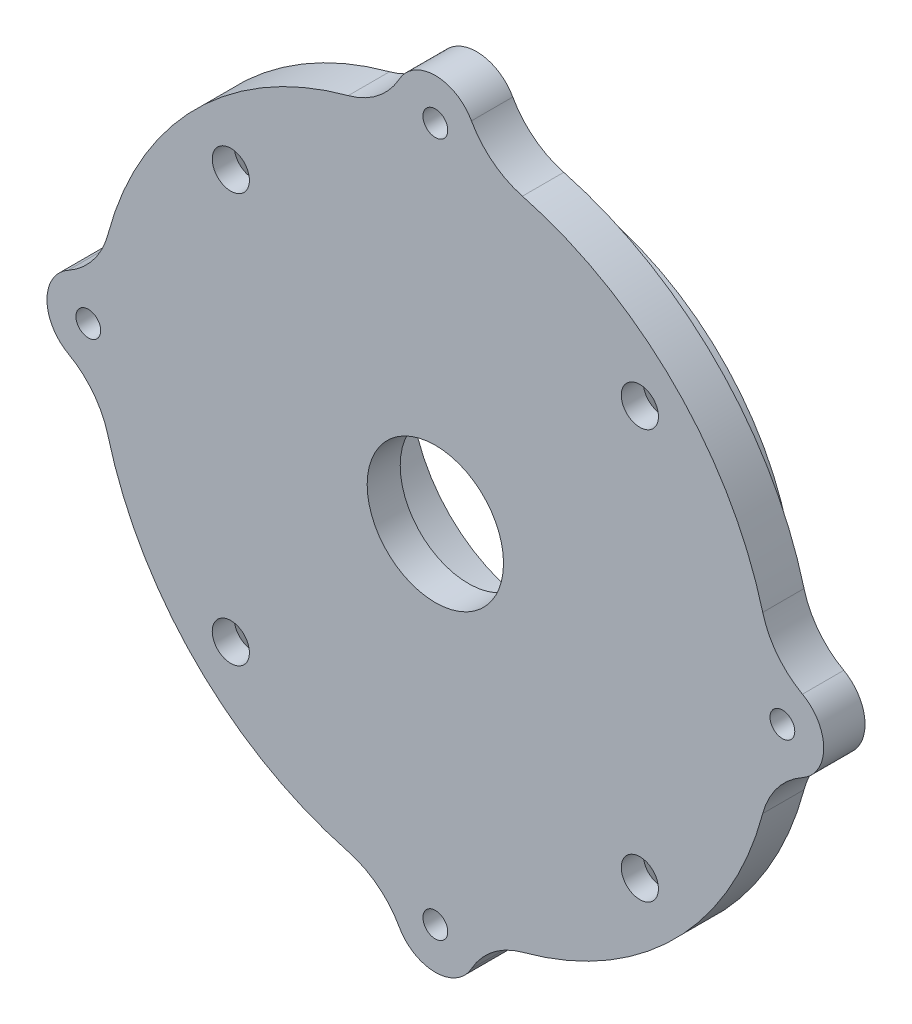
from build123d import *

# Parameters (mm, degrees)
IZIM1_R                                            = 22.5
IZIM1_R_2                                          = 16.25
Y_KSEKLIK_EKSTR_ZYON1_DEPTH                        = 8.25
IZIM1_R_3                                          = 30.3
IZIM1_R_4                                          = 28
Y_KSEKLIK_EKSTR_ZYON1_2_DEPTH                      = 8.25
IZIM2_R                                            = 2
IZIM2_R_2                                          = 1.5
IZIM2_R_3                                          = 8.25
Y_KSEKLIK_EKSTR_ZYON2_DEPTH                        = 5
M4_ALT_GEN_ALYAN_HAV_A_BA_L_VIDA_IN_HA_D           = 4.5
M4_ALT_GEN_ALYAN_HAV_A_BA_L_VIDA_IN_HA_CSINK_D     = 9.18
M4_ALT_GEN_ALYAN_HAV_A_BA_L_VIDA_IN_HA_CSINK_ANGLE = 90
IZIM7_R                                            = 16.25
KES_EKSTR_ZYON2_DEPTH                              = 1


with BuildPart() as part:
    # Çizim1 → Yükseklik-Ekstrüzyon1 (new body)
    with BuildSketch(Plane.XY):
        Circle(IZIM1_R)
        Circle(IZIM1_R_2, mode=Mode.SUBTRACT)
    extrude(amount=Y_KSEKLIK_EKSTR_ZYON1_DEPTH)



with BuildPart() as body_2:
    # Çizim1 → Y_kseklik-Ekstr_zyon1 2 (new body)
    with BuildSketch(Plane.XY):
        Circle(IZIM1_R_3)
        Circle(IZIM1_R_4, mode=Mode.SUBTRACT)
    extrude(amount=Y_KSEKLIK_EKSTR_ZYON1_2_DEPTH)


with BuildPart() as part_1:
    add(part.part)

    add(body_2.part)  # Yükseklik-Ekstrüzyon2 merges body 2
    # Çizim2 → Yükseklik-Ekstrüzyon2 (add)
    with BuildSketch(Plane.XY.offset(8.25)):
        with BuildLine():
            ThreePointArc((-10.540830255, 39.621848739), (-28.991378029, 28.991378029), (-39.621848739, 10.540830255))
            ThreePointArc((-39.621848739, 10.540830255), (-41.396931543, 6.966269622), (-44.428571429, 4.370588155))
            ThreePointArc((-44.428571429, 4.370588155), (-47, 0), (-44.428571429, -4.370588155))
            ThreePointArc((-44.428571429, -4.370588155), (-41.396931543, -6.966269622), (-39.621848739, -10.540830255))
            ThreePointArc((-39.621848739, -10.540830255), (-28.991378029, -28.991378029), (-10.540830255, -39.621848739))
            ThreePointArc((-10.540830255, -39.621848739), (-6.966269622, -41.396931543), (-4.370588155, -44.428571429))
            ThreePointArc((-4.370588155, -44.428571429), (0, -47), (4.370588155, -44.428571429))
            ThreePointArc((4.370588155, -44.428571429), (6.966269622, -41.396931543), (10.540830255, -39.621848739))
            ThreePointArc((10.540830255, -39.621848739), (28.991378029, -28.991378029), (39.621848739, -10.540830255))
            ThreePointArc((39.621848739, -10.540830255), (41.396931543, -6.966269622), (44.428571429, -4.370588155))
            ThreePointArc((44.428571429, -4.370588155), (47, 0), (44.428571429, 4.370588155))
            ThreePointArc((44.428571429, 4.370588155), (41.396931543, 6.966269622), (39.621848739, 10.540830255))
            ThreePointArc((39.621848739, 10.540830255), (28.991378029, 28.991378029), (10.540830255, 39.621848739))
            ThreePointArc((10.540830255, 39.621848739), (6.966269622, 41.396931543), (4.370588155, 44.428571429))
            ThreePointArc((4.370588155, 44.428571429), (0, 47), (-4.370588155, 44.428571429))
            ThreePointArc((-4.370588155, 44.428571429), (-6.966269622, 41.396931543), (-10.540830255, 39.621848739))
        make_face()
        with Locations((-24.75, 24.75)):
            Circle(IZIM2_R, mode=Mode.SUBTRACT)
        with Locations((24.75, 24.75)):
            Circle(IZIM2_R, mode=Mode.SUBTRACT)
        with Locations((24.75, -24.75)):
            Circle(IZIM2_R, mode=Mode.SUBTRACT)
        with Locations((-24.75, -24.75)):
            Circle(IZIM2_R, mode=Mode.SUBTRACT)
        with Locations((0, 42)):
            Circle(IZIM2_R_2, mode=Mode.SUBTRACT)
        with Locations((42, 0)):
            Circle(IZIM2_R_2, mode=Mode.SUBTRACT)
        with Locations((0, -42)):
            Circle(IZIM2_R_2, mode=Mode.SUBTRACT)
        with Locations((-42, 0)):
            Circle(IZIM2_R_2, mode=Mode.SUBTRACT)
        Circle(IZIM2_R_3, mode=Mode.SUBTRACT)
    extrude(amount=Y_KSEKLIK_EKSTR_ZYON2_DEPTH)

    # M4 Altıgen Alyan Havşa Başlı Vida İçin Havşa2 (through all)
    with Locations(Plane(origin=(24.75, 24.75, 8.25), x_dir=(-1, 0, 0), z_dir=(0, 0, -1))):
        with Locations((0, 0), (49.5, 0), (49.5, -49.5), (0, -49.5)):
            CounterSinkHole(M4_ALT_GEN_ALYAN_HAV_A_BA_L_VIDA_IN_HA_D / 2, M4_ALT_GEN_ALYAN_HAV_A_BA_L_VIDA_IN_HA_CSINK_D / 2, counter_sink_angle=M4_ALT_GEN_ALYAN_HAV_A_BA_L_VIDA_IN_HA_CSINK_ANGLE)

    # Çizim7 → Kes-Ekstrüzyon2 (cut)
    with BuildSketch(Plane(origin=(0, 0, 8.25), x_dir=(-1, 0, 0), z_dir=(0, 0, -1))):
        Circle(IZIM7_R)
    extrude(amount=-KES_EKSTR_ZYON2_DEPTH, mode=Mode.SUBTRACT)


solid = part_1.part
